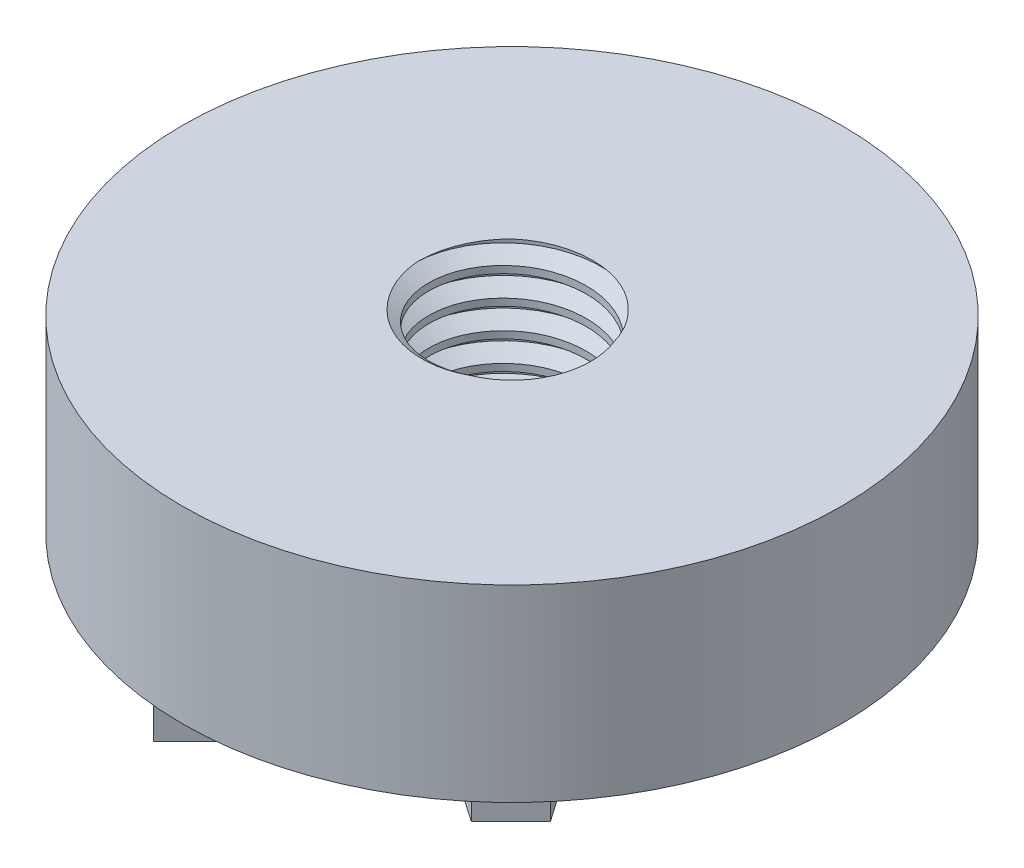
from build123d import *

# Parameters (mm, degrees)
ROSCA1_PITCH            = 1.5
CROQUIS5_R              = 17.5
CORTAR_EXTRUIR1_DEPTH   = 10
SALIENTE_EXTRUIR1_DEPTH = 2


with BuildPart() as part:
    # Croquis1 → Revolución1 (revolve)
    with BuildSketch(Plane.XY, mode=Mode.PRIVATE) as revoluci_n1_sk:
        Polygon((5, 0), (-7.5, 0), (-7.5, -5), (-7.5, -10), (10, -10), (10, -8), (5, -8), align=None)
    revolve(revoluci_n1_sk.sketch.rotate(Axis((10, -10, 0), (0, 1, 0)), 270), axis=Axis((10, -10, 0), (0, 1, 0)))

    # Rosca1: the profile of Perfil de rosca1 profile screwed along a right-hand helix of 6.333333 turns, 8 arcs to a turn; built about Z, then put on its axis
    rosca1_z = Axis((0, 0, 0), (0, 0, 1))
    rosca1_corners = [(5.0003, 0, -0.000173205), (5.0003, 0, 1.312673201), (4.188101187, 0, 0.843749998), (4.188101187, 0, 0.468749998)]
    with BuildLine(mode=Mode.PRIVATE) as rosca1_profile:
        Line(rosca1_corners[0], rosca1_corners[1])
        Line(rosca1_corners[1], rosca1_corners[2])
        Line(rosca1_corners[2], rosca1_corners[3])
        Line(rosca1_corners[3], rosca1_corners[0])
    rosca1_cap = Face(rosca1_profile.wire())
    rosca1_turn_angles = [0, 22.5, 45, 67.5, 90, 112.5, 135, 157.5, 180, 202.5, 225, 247.5, 270, 292.5, 315, 337.5, 360]
    rosca1_turn_weights = [1, 0.9238795325112867, 1, 0.9238795325112867, 1, 0.9238795325112867, 1, 0.9238795325112867, 1, 0.9238795325112867, 1, 0.9238795325112867, 1, 0.9238795325112867, 1, 0.9238795325112867, 1]
    rosca1_turn_rails = [Edge.make_bspline([Vector(p[0], p[1], 0).rotate(rosca1_z, rosca1_turn_angles[k]) / rosca1_turn_weights[k] + Vector(0, 0, p[2] + ROSCA1_PITCH * rosca1_turn_angles[k] / 360) for k in range(17)], [0, 0, 0, 1, 1, 2, 2, 3, 3, 4, 4, 5, 5, 6, 6, 7, 7, 8, 8, 8], 2, rosca1_turn_weights) for p in rosca1_corners]
    rosca1_turn_sides = [Face.make_surface_from_curves(rosca1_turn_rails[p[0]], rosca1_turn_rails[p[1]]) for p in [(0, 1), (1, 2), (2, 3), (3, 0)]]
    rosca1_last_angles = [2160, 2182.5, 2205, 2227.5, 2250, 2265, 2280]
    rosca1_last_weights = [1, 0.9238795325112867, 1, 0.9238795325112867, 1, 0.9659258262890714, 1]
    rosca1_last_rails = [Edge.make_bspline([Vector(p[0], p[1], 0).rotate(rosca1_z, rosca1_last_angles[k]) / rosca1_last_weights[k] + Vector(0, 0, p[2] + ROSCA1_PITCH * rosca1_last_angles[k] / 360) for k in range(7)], [0, 0, 0, 1, 1, 2, 2, 3, 3, 3], 2, rosca1_last_weights) for p in rosca1_corners]
    rosca1_last_sides = [Face.make_surface_from_curves(rosca1_last_rails[p[0]], rosca1_last_rails[p[1]]) for p in [(0, 1), (1, 2), (2, 3), (3, 0)]]
    rosca1 = Plane(origin=(10, 1.5, 0), x_dir=(-1, 0, 0), z_dir=(0, -1, 0)) * Solid(Shell([*[p.moved(Location((0, 0, ROSCA1_PITCH * i))) for i in range(6) for p in rosca1_turn_sides], *rosca1_last_sides, rosca1_cap, rosca1_cap.rotate(rosca1_z, 2280).moved(Location((0, 0, ROSCA1_PITCH * 2280 / 360)))]))
    add(rosca1)

    # Croquis5 → Cortar-Extruir1 (cut)
    with BuildSketch(Plane(origin=(0, 0, 0), x_dir=(1, 0, 0), z_dir=(0, 1, 0))):
        with Locations(Location((10, 0, 0), (0, 0, 90))):
            Circle(CROQUIS5_R)
    extrude(amount=CORTAR_EXTRUIR1_DEPTH, mode=Mode.SUBTRACT)

    # Croquis4 → Saliente-Extruir1 (add)
    # profile 1 of 2: a face of its own
    with BuildSketch(Plane.XZ.offset(10)):
        with BuildLine():
            Line((10.071299898, 2.363231056), (16.432037592, 8.723968749))
            Line((16.432037592, 8.723968749), (16.931473292, 10.109196069))
            Line((16.931473292, 10.109196069), (20.154247057, 12.314251803))
            Line((20.154247057, 12.314251803), (22.255646325, 10.212852536))
            Line((22.255646325, 10.212852536), (20.041167276, 7.018348716))
            Line((20.041167276, 7.018348716), (18.599400065, 6.556606276))
            Line((18.599400065, 6.556606276), (12.238662371, 0.195868582))
            Line((12.238662371, 0.195868582), (13.774662733, -1.340131779))
            Line((13.774662733, -1.340131779), (12.10673596, -3.008058552))
            Line((12.10673596, -3.008058552), (10.432811271, -3.54415208))
            Line((10.432811271, -3.54415208), (9.844230287, -5.176631413))
            Line((9.844230287, -5.176631413), (3.296086509, -11.724775191))
            ThreePointArc((3.296086509, -11.724775191), (-1.539262366, -11.471383741), (-1.792653815, -6.636034866))
            Line((-1.792653815, -6.636034866), (4.81889137, -0.151292497))
            Line((4.81889137, -0.151292497), (6.420827725, 0.60161759))
            Line((6.420827725, 0.60161759), (6.97102923, 2.127648178))
            Line((6.97102923, 2.127648178), (8.638956003, 3.795574951))
            Line((8.638956003, 3.795574951), (10.071299898, 2.363231056))
        make_face()
        with BuildLine():
            Line((0.139125781, -7.945875665), (5.689458376, -2.395543071))
            ThreePointArc((5.689458376, -2.395543071), (7.415406244, -2.443404293), (7.621237972, -4.157702995))
            Line((7.621237972, -4.157702995), (1.835322499, -9.943618467))
            ThreePointArc((1.835322499, -9.943618467), (0.175207518, -9.634195141), (0.139125781, -7.945875665))
        make_face(mode=Mode.SUBTRACT)
    # profile 2 of 2: a face of its own
    with BuildSketch(Plane.XZ.offset(10)):
        Polygon((15.804308765, 9.351757628), (14.84971461, 8.397163473), (14.178363017, 9.068515066), (10.023533351, 4.9136854), (10.694884944, 4.242333807), (9.722418173, 3.269867037), (1.986520568, 11.005764642), (2.941114723, 11.960358796), (3.569941363, 11.331532156), (7.8120033, 15.573594093), (7.18317666, 16.202420734), (8.068411159, 17.087655233), align=None)
        Polygon((8.831855805, 6.144205222), (12.969959824, 10.282309241), (11.574988596, 11.677280469), (7.436884576, 7.53917645), align=None, mode=Mode.SUBTRACT)
        Polygon((6.252092277, 8.723968749), (4.81889137, 10.157169656), (8.962445053, 14.300723339), (10.39564596, 12.867522433), align=None, mode=Mode.SUBTRACT)
    extrude(amount=SALIENTE_EXTRUIR1_DEPTH)


solid = part.part
